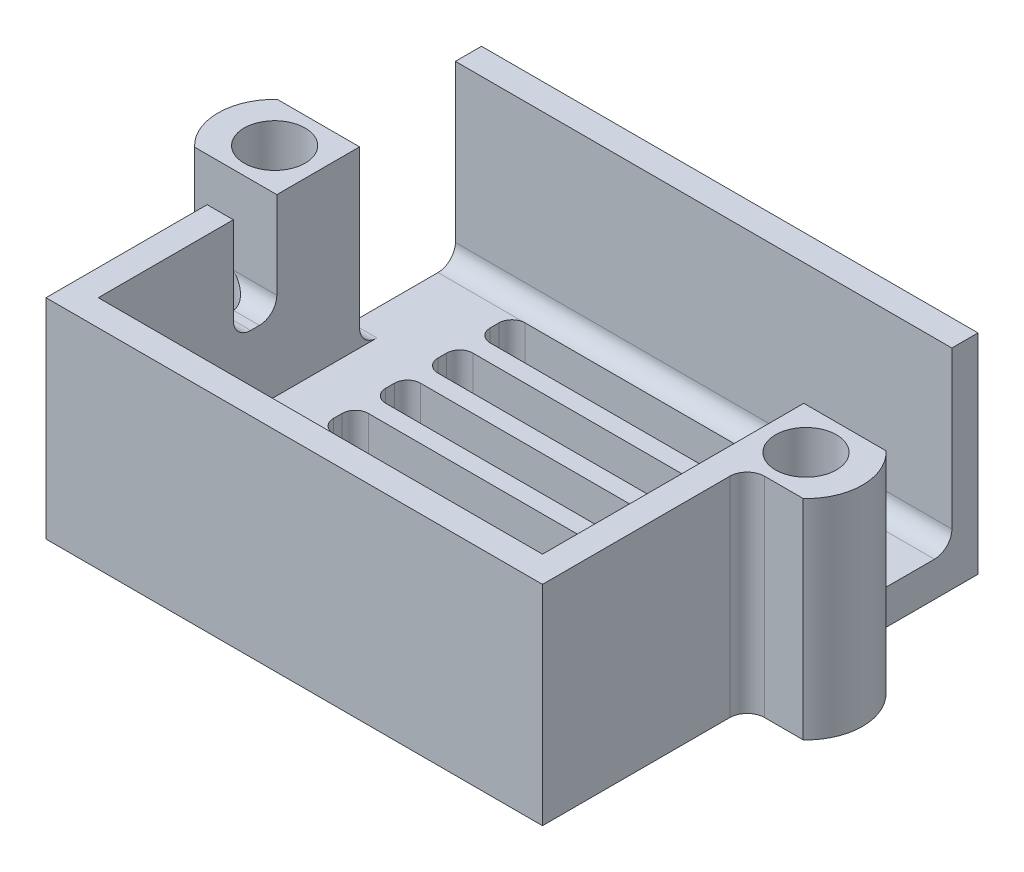
from build123d import *

# Parameters (mm, degrees)
SKETCH1_W           = 28.5
SKETCH1_H           = 25
BOSS_EXTRUDE1_DEPTH = 2
SKETCH2_W           = 28.5
SKETCH2_H           = 25
SKETCH2_W_2         = 25.5
SKETCH2_H_2         = 22
BOSS_EXTRUDE2_DEPTH = 10
SKETCH3_W           = 1.5
SKETCH3_H           = 7
CUT_EXTRUDE1_DEPTH  = 10
SKETCH4_W           = 1.5
SKETCH4_H           = 2.5
CUT_EXTRUDE2_DEPTH  = 6
BOSS_EXTRUDE3_DEPTH = 12
CUT_EXTRUDE3_REACH  = 27.348
SKETCH6_R           = 1.75
FILLET1_R           = 1


with BuildPart() as part:
    # Sketch1 → Boss-Extrude1 (new body)
    with BuildSketch(Plane(origin=(0, 0, 0), x_dir=(1, 0, 0), z_dir=(0, 1, 0))):
        Rectangle(SKETCH1_W, SKETCH1_H)
        with BuildLine():
            Line((-9.25, 5), (9.25, 5))
            ThreePointArc((9.25, 5), (9.780330086, 5.219669914), (10, 5.75))
            Line((10, 5.75), (10, 6.25))
            ThreePointArc((10, 6.25), (9.780330086, 6.780330086), (9.25, 7))
            Line((9.25, 7), (-9.25, 7))
            ThreePointArc((-9.25, 7), (-9.780330086, 6.780330086), (-10, 6.25))
            Line((-10, 6.25), (-10, 5.75))
            ThreePointArc((-10, 5.75), (-9.780330086, 5.219669914), (-9.25, 5))
        make_face(mode=Mode.SUBTRACT)
        with BuildLine():
            Line((-9.25, 4), (9.25, 4))
            ThreePointArc((9.25, 4), (9.780330086, 3.780330086), (10, 3.25))
            Line((10, 3.25), (10, 2.75))
            ThreePointArc((10, 2.75), (9.780330086, 2.219669914), (9.25, 2))
            Line((9.25, 2), (-9.25, 2))
            ThreePointArc((-9.25, 2), (-9.780330086, 2.219669914), (-10, 2.75))
            Line((-10, 2.75), (-10, 3.25))
            ThreePointArc((-10, 3.25), (-9.780330086, 3.780330086), (-9.25, 4))
        make_face(mode=Mode.SUBTRACT)
        with BuildLine():
            Line((-9.25, 8), (9.25, 8))
            ThreePointArc((9.25, 8), (9.780330086, 8.219669914), (10, 8.75))
            Line((10, 8.75), (10, 9.25))
            ThreePointArc((10, 9.25), (9.780330086, 9.780330086), (9.25, 10))
            Line((9.25, 10), (-9.25, 10))
            ThreePointArc((-9.25, 10), (-9.780330086, 9.780330086), (-10, 9.25))
            Line((-10, 9.25), (-10, 8.75))
            ThreePointArc((-10, 8.75), (-9.780330086, 8.219669914), (-9.25, 8))
        make_face(mode=Mode.SUBTRACT)
        with BuildLine():
            Line((10, -9.25), (10, -8.75))
            ThreePointArc((10, -8.75), (9.780330086, -8.219669914), (9.25, -8))
            Line((9.25, -8), (-9.25, -8))
            ThreePointArc((-9.25, -8), (-9.780330086, -8.219669914), (-10, -8.75))
            Line((-10, -8.75), (-10, -9.25))
            ThreePointArc((-10, -9.25), (-9.780330086, -9.780330086), (-9.25, -10))
            Line((-9.25, -10), (9.25, -10))
            ThreePointArc((9.25, -10), (9.780330086, -9.780330086), (10, -9.25))
        make_face(mode=Mode.SUBTRACT)
        with BuildLine():
            Line((10, -6.25), (10, -5.75))
            ThreePointArc((10, -5.75), (9.780330086, -5.219669914), (9.25, -5))
            Line((9.25, -5), (-9.25, -5))
            ThreePointArc((-9.25, -5), (-9.780330086, -5.219669914), (-10, -5.75))
            Line((-10, -5.75), (-10, -6.25))
            ThreePointArc((-10, -6.25), (-9.780330086, -6.780330086), (-9.25, -7))
            Line((-9.25, -7), (9.25, -7))
            ThreePointArc((9.25, -7), (9.780330086, -6.780330086), (10, -6.25))
        make_face(mode=Mode.SUBTRACT)
        with BuildLine():
            Line((10, -3.25), (10, -2.75))
            ThreePointArc((10, -2.75), (9.780330086, -2.219669914), (9.25, -2))
            Line((9.25, -2), (-9.25, -2))
            ThreePointArc((-9.25, -2), (-9.780330086, -2.219669914), (-10, -2.75))
            Line((-10, -2.75), (-10, -3.25))
            ThreePointArc((-10, -3.25), (-9.780330086, -3.780330086), (-9.25, -4))
            Line((-9.25, -4), (9.25, -4))
            ThreePointArc((9.25, -4), (9.780330086, -3.780330086), (10, -3.25))
        make_face(mode=Mode.SUBTRACT)
        with BuildLine():
            Line((-10, 0.25), (-10, -0.25))
            ThreePointArc((-10, -0.25), (-9.780330086, -0.780330086), (-9.25, -1))
            Line((-9.25, -1), (9.25, -1))
            ThreePointArc((9.25, -1), (9.780330086, -0.780330086), (10, -0.25))
            Line((10, -0.25), (10, 0.25))
            ThreePointArc((10, 0.25), (9.780330086, 0.780330086), (9.25, 1))
            Line((9.25, 1), (-9.25, 1))
            ThreePointArc((-9.25, 1), (-9.780330086, 0.780330086), (-10, 0.25))
        make_face(mode=Mode.SUBTRACT)
    extrude(amount=BOSS_EXTRUDE1_DEPTH)

    # Sketch2 → Boss-Extrude2 (add)
    with BuildSketch(Plane(origin=(0, 2, 0), x_dir=(1, 0, 0), z_dir=(0, 1, 0))):
        Rectangle(SKETCH2_W, SKETCH2_H)
        Rectangle(SKETCH2_W_2, SKETCH2_H_2, mode=Mode.SUBTRACT)
    extrude(amount=BOSS_EXTRUDE2_DEPTH)

    # Sketch3 → Cut-Extrude1 (cut)
    with BuildSketch(Plane(origin=(0, 12, 0), x_dir=(1, 0, 0), z_dir=(0, 1, 0))):
        with Locations((-13.5, 7.5)):
            Rectangle(SKETCH3_W, SKETCH3_H)
        with Locations((13.5, 7.5)):
            Rectangle(SKETCH3_W, SKETCH3_H)
    extrude(amount=-CUT_EXTRUDE1_DEPTH, mode=Mode.SUBTRACT)

    # Sketch4 → Cut-Extrude2 (cut)
    with BuildSketch(Plane(origin=(0, 12, 0), x_dir=(1, 0, 0), z_dir=(0, 1, 0))):
        with Locations((-13.5, -2)):
            Rectangle(SKETCH4_W, SKETCH4_H)
    extrude(amount=-CUT_EXTRUDE2_DEPTH, mode=Mode.SUBTRACT)

    # Sketch5 → Boss-Extrude3 (add)
    with BuildSketch(Plane.XZ):
        with BuildLine():
            Line((-17.468529919, -4), (-14.25, -4))
            Line((-14.25, -4), (-14.25, 0.75))
            Line((-14.25, 0.75), (-17.468529919, 0.75))
            ThreePointArc((-17.468529919, 0.75), (-18.5, -1.625), (-17.468529919, -4))
        make_face()
        with BuildLine():
            Line((14.25, 0.75), (14.25, -4))
            Line((14.25, -4), (17.468529919, -4))
            ThreePointArc((17.468529919, -4), (18.5, -1.625), (17.468529919, 0.75))
            Line((17.468529919, 0.75), (14.25, 0.75))
        make_face()
    extrude(amount=-BOSS_EXTRUDE3_DEPTH)

    # Sketch6 → Cut-Extrude3 (cut, up to next)
    with BuildSketch(Plane.XZ, mode=Mode.PRIVATE) as cut_extrude3_sk1:
        with Locations(Location((-15.25, -1.625, 0), (0, 0, 270))):
            Circle(SKETCH6_R)
    cut_extrude3_tool1 = extrude(cut_extrude3_sk1.sketch, amount=-CUT_EXTRUDE3_REACH, mode=Mode.PRIVATE) & part.part
    # Sketch6 → Cut-Extrude3 (cut, up to next)
    with BuildSketch(Plane.XZ, mode=Mode.PRIVATE) as cut_extrude3_sk2:
        with Locations(Location((15.25, -1.625, 0), (0, 0, 90))):
            Circle(SKETCH6_R)
    cut_extrude3_tool2 = extrude(cut_extrude3_sk2.sketch, amount=-CUT_EXTRUDE3_REACH, mode=Mode.PRIVATE) & part.part
    add(cut_extrude3_tool1.solids().sort_by_distance((-15.25, 0, -1.625))[0], mode=Mode.SUBTRACT)
    add(cut_extrude3_tool2.solids().sort_by_distance((15.25, 0, -1.625))[0], mode=Mode.SUBTRACT)

    # Fillet1
    fillet1_edges = [part.edges().sort_by_distance(p)[0] for p in [
        (-14.25, 1, -4),
        (14.25, 1, -4),
        (-14.25, 3, 0.75),
        (14.25, 6, 0.75),
        (-13.5, 6, 0.75),
        (-13.5, 6, 3.25),
        (13.5, 2, -4),
        (-13.5, 2, -4),
        (0, 2, -11),
    ]]
    fillet(fillet1_edges, radius=FILLET1_R - 0.0001)  # a hair under: the kernel refuses the full size


solid = part.part
